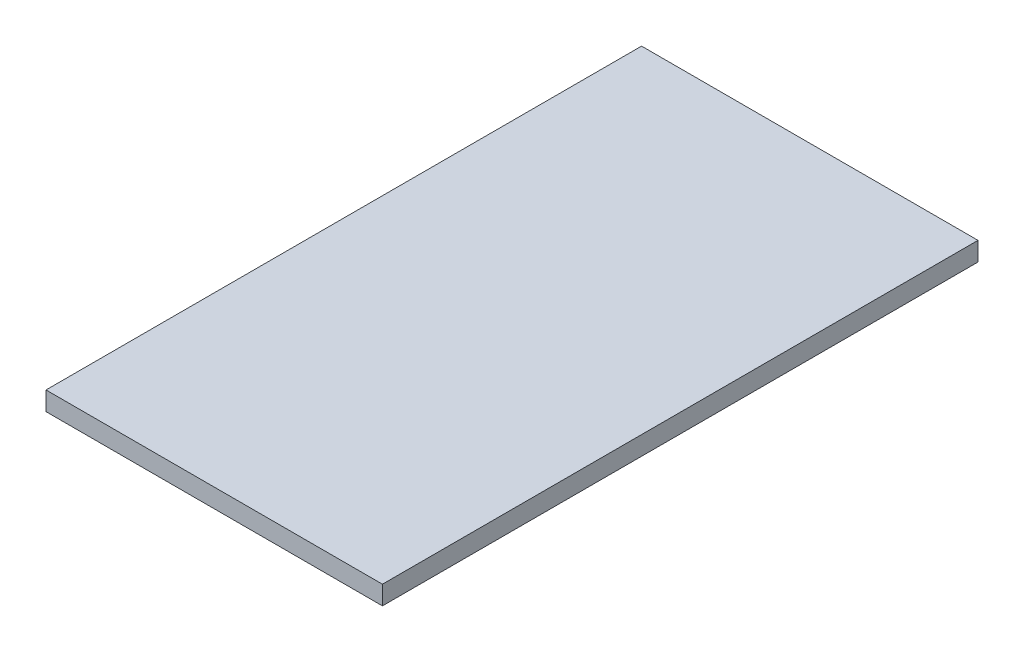
from build123d import *

# Parameters (mm, degrees)
SKETCH1_W           = 161
SKETCH1_H           = 285
BOSS_EXTRUDE1_DEPTH = 9


with BuildPart() as part:
    # Sketch1 → Boss-Extrude1 (new body)
    with BuildSketch(Plane(origin=(0, 0, 0), x_dir=(1, 0, 0), z_dir=(0, 1, 0))):
        Rectangle(SKETCH1_W, SKETCH1_H)
    extrude(amount=BOSS_EXTRUDE1_DEPTH)


solid = part.part
